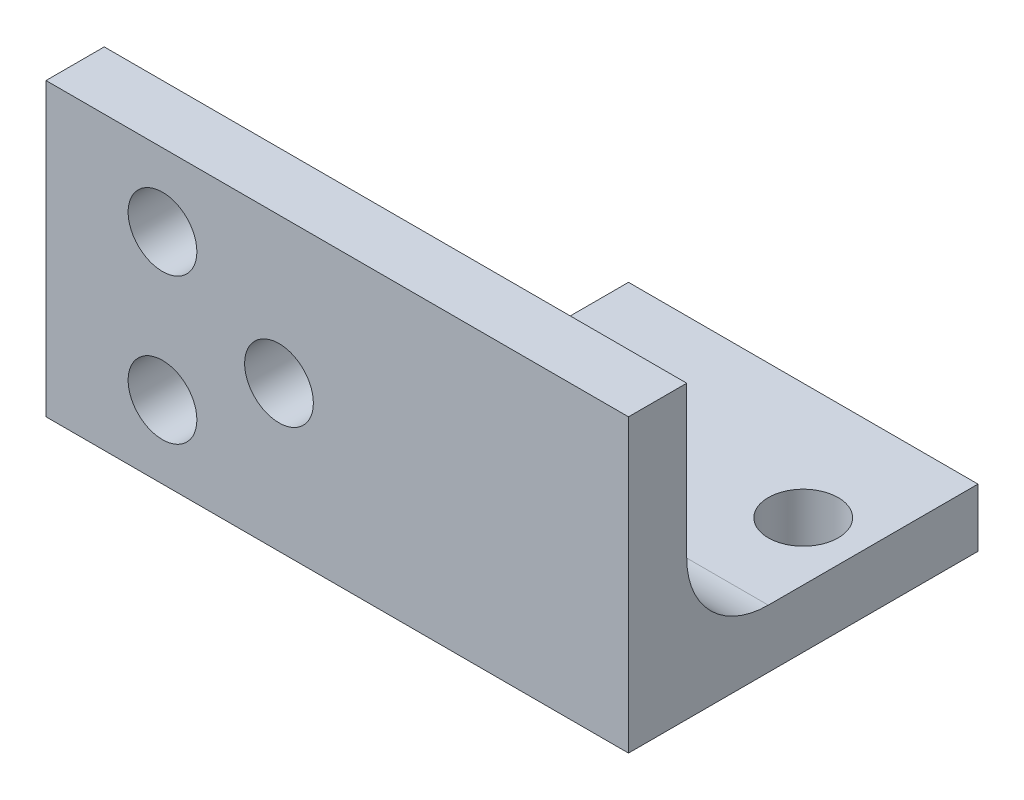
from build123d import *

# Parameters (mm, degrees)
CROQUIS1_W              = 50
CROQUIS1_H              = 25
CROQUIS1_R              = 2.95
SALIENTE_EXTRUIR1_DEPTH = 5
CROQUIS2_W              = 30
CROQUIS2_H              = 25
CROQUIS2_R              = 3
SALIENTE_EXTRUIR2_DEPTH = 5
REDONDEO1_R             = 7


with BuildPart() as part:
    # Croquis1 → Saliente-Extruir1 (new body)
    with BuildSketch(Plane.XY):
        with Locations((25, 12.5)):
            Rectangle(CROQUIS1_W, CROQUIS1_H)
        with Locations((10, 18.75)):
            Circle(CROQUIS1_R, mode=Mode.SUBTRACT)
        with Locations((10, 6.25)):
            Circle(CROQUIS1_R, mode=Mode.SUBTRACT)
        with Locations((20, 12.5)):
            Circle(CROQUIS1_R, mode=Mode.SUBTRACT)
    extrude(amount=SALIENTE_EXTRUIR1_DEPTH)

    # Croquis2 → Saliente-Extruir2 (add)
    with BuildSketch(Plane.XZ):
        with Locations((35, -12.5)):
            Rectangle(CROQUIS2_W, CROQUIS2_H)
        with Locations(Location((45, -15, 0), (0, 0, 270))):
            Circle(CROQUIS2_R, mode=Mode.SUBTRACT)
        with Locations(Location((25, -15, 0), (0, 0, 270))):
            Circle(CROQUIS2_R, mode=Mode.SUBTRACT)
    extrude(amount=-SALIENTE_EXTRUIR2_DEPTH)

    # Redondeo1
    # the kernel refuses this fillet: 7 mm, written as the material it adds along each edge
    with BuildSketch(Plane(origin=(20, 5, 0), x_dir=(0, 0, -1), z_dir=(1, 0, 0))) as redondeo1_piece_1_section:
        with BuildLine():
            CenterArc((REDONDEO1_R, REDONDEO1_R), REDONDEO1_R, 180, 90)
            Line((0, REDONDEO1_R), (0, 0))
            Line((0, 0), (REDONDEO1_R, 0))
        make_face()
    redondeo1_piece_1 = extrude(amount=30, mode=Mode.PRIVATE)
    redondeo1_piece_1 = redondeo1_piece_1 - Plane(origin=(20, 12.5, -1.59035859), x_dir=(1, 0, 0), z_dir=(0, 0, -1)) * Cylinder(2.95, 88, mode=Mode.PRIVATE)
    add(redondeo1_piece_1)


solid = part.part
